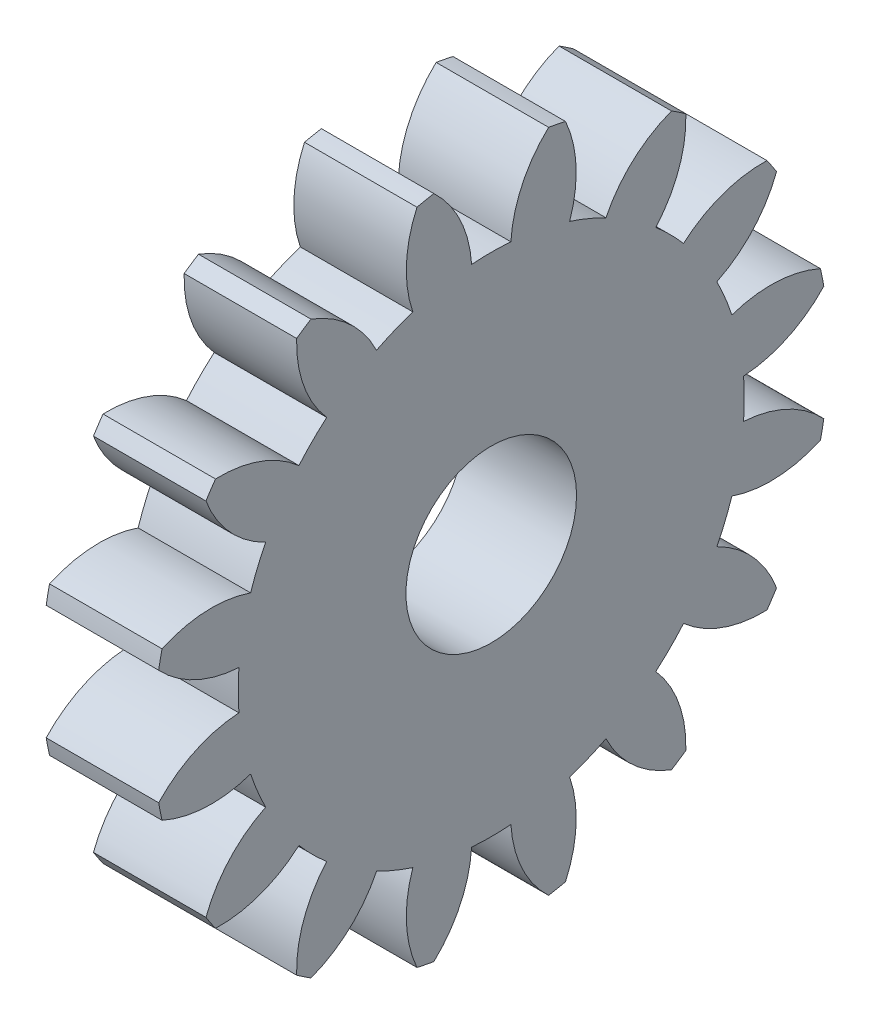
from build123d import *

# Parameters (mm, degrees)
SPUR_START              = -122.221816322
SPUR_GEAR_ISO_OUTLINE_R = 1
SPUR_GEAR_ISO_DEPTH     = 3
SKETCH1_R               = 2.275
CUT_EXTRUDE1_DEPTH      = 10


# Read off the part's stored shape, not the designer's step: spur gear_iso
with BuildPart() as part:
    # spur gear_iso outline → spur gear_iso (new body)
    with BuildSketch(Plane.YZ.offset(SPUR_START)):
        with BuildLine():
            ThreePointArc((2.854590328, 8.779377764), (2.629866412, 8.827067524), (2.403998504, 8.869006051))
            ThreePointArc((2.403998504, 8.869006051), (1.695929768, 7.895188691), (1.397846451, 6.728643397))
            ThreePointArc((1.397846451, 6.728643397), (0.874053513, 6.749), (0.350260576, 6.728643397))
            ThreePointArc((0.350260576, 6.728643397), (0.052177259, 7.895188691), (-0.655891477, 8.869006051))
            ThreePointArc((-0.655891477, 8.869006051), (-0.881759385, 8.827067524), (-1.106483301, 8.779377764))
            ThreePointArc((-1.106483301, 8.779377764), (-1.387989744, 7.608721662), (-1.216965263, 6.416902795))
            ThreePointArc((-1.216965263, 6.416902795), (-1.708676972, 6.235262965), (-2.184808411, 6.016009037))
            ThreePointArc((-2.184808411, 6.016009037), (-2.906619044, 6.97968481), (-3.933453026, 7.608408563))
            ThreePointArc((-3.933453026, 7.608408563), (-4.126078584, 7.483226511), (-4.315446329, 7.353168799))
            ThreePointArc((-4.315446329, 7.353168799), (-4.127533675, 6.163895735), (-3.513438322, 5.128246912))
            ThreePointArc((-3.513438322, 5.128246912), (-3.898210152, 4.772263666), (-4.254193398, 4.387491836))
            ThreePointArc((-4.254193398, 4.387491836), (-5.289842221, 5.001587189), (-6.479115285, 5.189499843))
            ThreePointArc((-6.479115285, 5.189499843), (-6.609172997, 5.000132097), (-6.73435505, 4.80750654))
            ThreePointArc((-6.73435505, 4.80750654), (-6.105631296, 3.780672557), (-5.141955523, 3.058861924))
            ThreePointArc((-5.141955523, 3.058861924), (-5.361209451, 2.582730485), (-5.542849281, 2.091018776))
            ThreePointArc((-5.542849281, 2.091018776), (-6.734668149, 2.262043257), (-7.905324251, 1.980536814))
            ThreePointArc((-7.905324251, 1.980536814), (-7.95301401, 1.755812898), (-7.994952537, 1.529944991))
            ThreePointArc((-7.994952537, 1.529944991), (-7.021135177, 0.821876255), (-5.854589883, 0.523792937))
            ThreePointArc((-5.854589883, 0.523792937), (-5.874946486, 0), (-5.854589883, -0.523792937))
            ThreePointArc((-5.854589883, -0.523792937), (-7.021135177, -0.821876255), (-7.994952537, -1.529944991))
            ThreePointArc((-7.994952537, -1.529944991), (-7.95301401, -1.755812898), (-7.905324251, -1.980536814))
            ThreePointArc((-7.905324251, -1.980536814), (-6.734668149, -2.262043257), (-5.542849281, -2.091018776))
            ThreePointArc((-5.542849281, -2.091018776), (-5.361209451, -2.582730485), (-5.141955523, -3.058861924))
            ThreePointArc((-5.141955523, -3.058861924), (-6.105631296, -3.780672557), (-6.73435505, -4.80750654))
            ThreePointArc((-6.73435505, -4.80750654), (-6.609172997, -5.000132097), (-6.479115285, -5.189499843))
            ThreePointArc((-6.479115285, -5.189499843), (-5.289842221, -5.001587189), (-4.254193398, -4.387491836))
            ThreePointArc((-4.254193398, -4.387491836), (-3.898210153, -4.772263667), (-3.513438322, -5.128246912))
            ThreePointArc((-3.513438322, -5.128246912), (-4.127533675, -6.163895735), (-4.315446329, -7.353168799))
            ThreePointArc((-4.315446329, -7.353168799), (-4.126078584, -7.483226511), (-3.933453026, -7.608408563))
            ThreePointArc((-3.933453026, -7.608408563), (-2.906619044, -6.97968481), (-2.184808411, -6.016009037))
            ThreePointArc((-2.184808411, -6.016009037), (-1.708676972, -6.235262965), (-1.216965263, -6.416902795))
            ThreePointArc((-1.216965263, -6.416902795), (-1.387989744, -7.608721662), (-1.106483301, -8.779377764))
            ThreePointArc((-1.106483301, -8.779377764), (-0.881759385, -8.827067524), (-0.655891477, -8.869006051))
            ThreePointArc((-0.655891477, -8.869006051), (0.052177259, -7.895188691), (0.350260576, -6.728643397))
            ThreePointArc((0.350260576, -6.728643397), (0.874053513, -6.749), (1.397846451, -6.728643397))
            ThreePointArc((1.397846451, -6.728643397), (1.695929768, -7.895188691), (2.403998504, -8.869006051))
            ThreePointArc((2.403998504, -8.869006051), (2.629866412, -8.827067524), (2.854590328, -8.779377764))
            ThreePointArc((2.854590328, -8.779377764), (3.136096771, -7.608721662), (2.96507229, -6.416902795))
            ThreePointArc((2.96507229, -6.416902795), (3.456783999, -6.235262965), (3.932915438, -6.016009037))
            ThreePointArc((3.932915438, -6.016009037), (4.654726071, -6.97968481), (5.681560054, -7.608408563))
            ThreePointArc((5.681560054, -7.608408563), (5.874185611, -7.483226511), (6.063553357, -7.353168799))
            ThreePointArc((6.063553357, -7.353168799), (5.875640702, -6.163895735), (5.26154535, -5.128246912))
            ThreePointArc((5.26154535, -5.128246912), (5.64631718, -4.772263666), (6.002300425, -4.387491836))
            ThreePointArc((6.002300425, -4.387491836), (7.037949248, -5.001587189), (8.227222312, -5.189499843))
            ThreePointArc((8.227222312, -5.189499843), (8.357280024, -5.000132097), (8.482462077, -4.80750654))
            ThreePointArc((8.482462077, -4.80750654), (7.853738324, -3.780672557), (6.89006255, -3.058861924))
            ThreePointArc((6.89006255, -3.058861924), (7.109316479, -2.582730485), (7.290956308, -2.091018776))
            ThreePointArc((7.290956308, -2.091018776), (8.482775176, -2.262043257), (9.653431278, -1.980536814))
            ThreePointArc((9.653431278, -1.980536814), (9.701121037, -1.755812898), (9.743059564, -1.529944991))
            ThreePointArc((9.743059564, -1.529944991), (8.769242204, -0.821876255), (7.60269691, -0.523792937))
            ThreePointArc((7.60269691, -0.523792937), (7.623053514, 0), (7.60269691, 0.523792937))
            ThreePointArc((7.60269691, 0.523792937), (8.769242204, 0.821876255), (9.743059564, 1.529944991))
            ThreePointArc((9.743059564, 1.529944991), (9.701121037, 1.755812898), (9.653431278, 1.980536814))
            ThreePointArc((9.653431278, 1.980536814), (8.482775176, 2.262043257), (7.290956308, 2.091018776))
            ThreePointArc((7.290956308, 2.091018776), (7.109316479, 2.582730485), (6.89006255, 3.058861924))
            ThreePointArc((6.89006255, 3.058861924), (7.853738324, 3.780672557), (8.482462077, 4.80750654))
            ThreePointArc((8.482462077, 4.80750654), (8.357280024, 5.000132097), (8.227222312, 5.189499843))
            ThreePointArc((8.227222312, 5.189499843), (7.037949248, 5.001587189), (6.002300425, 4.387491836))
            ThreePointArc((6.002300425, 4.387491836), (5.64631718, 4.772263666), (5.26154535, 5.128246912))
            ThreePointArc((5.26154535, 5.128246912), (5.875640702, 6.163895735), (6.063553357, 7.353168799))
            ThreePointArc((6.063553357, 7.353168799), (5.874185611, 7.483226511), (5.681560054, 7.608408563))
            ThreePointArc((5.681560054, 7.608408563), (4.654726071, 6.97968481), (3.932915438, 6.016009037))
            ThreePointArc((3.932915438, 6.016009037), (3.456783999, 6.235262965), (2.96507229, 6.416902795))
            ThreePointArc((2.96507229, 6.416902795), (3.136096771, 7.608721662), (2.854590328, 8.779377764))
        make_face()
        with Locations((0.874053514, 0)):
            Circle(SPUR_GEAR_ISO_OUTLINE_R, mode=Mode.SUBTRACT)
    extrude(amount=SPUR_GEAR_ISO_DEPTH)

    # Sketch1 → Cut-Extrude1 (cut)
    with BuildSketch(Plane(origin=(-119.221816322, 0, 0), x_dir=(0, 0, -1), z_dir=(1, 0, 0))):
        with Locations((0, 0.874053514)):
            Circle(SKETCH1_R)
    extrude(amount=-CUT_EXTRUDE1_DEPTH, mode=Mode.SUBTRACT)


solid = part.part
